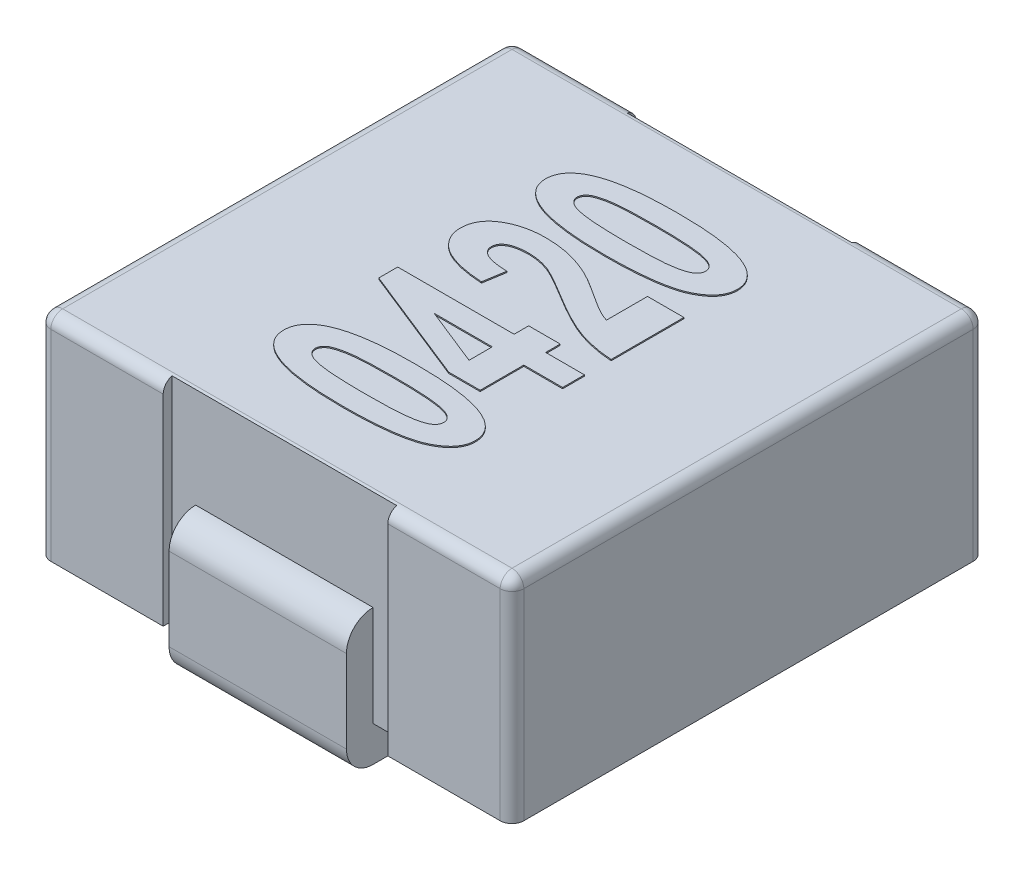
from build123d import *

# Parameters (mm, degrees)
EXTRUDE_1_DEPTH     = 1.8
CUT_EXTRUDE_1_DEPTH = 0.1
CUT_EXTRUDE_2_REACH = 5.3
EXTRUDE_START       = -0.75
EXTRUDE_1_2_DEPTH   = 1.5
EXTRUDE_2_DEPTH     = 1.5
FILLET_1_R          = 0.1
EXTRUDE_2_2_DEPTH   = 0.01


# Read off the part's stored shape, not the designer's step: Вытянуть-Тонкостенный1, Вытянуть-Тонкостенный2
with BuildPart() as part:
    # Эскиз1 → Extrude 1 (new body)
    with BuildSketch(Plane(origin=(0, 0, 0), x_dir=(1, 0, 0), z_dir=(0, 1, 0))):
        with BuildLine():
            Line((-1.900000000000001, -2.0000000000000013), (1.899999999999999, -2.000000000000001))
            ThreePointArc((1.899999999999999, -2.000000000000001), (1.970710678118654, -1.9707106781186554), (1.9999999999999996, -1.9000000000000004))
            Line((1.9999999999999996, -1.9000000000000004), (1.9999999999999991, 1.8999999999999992))
            ThreePointArc((1.9999999999999991, 1.8999999999999992), (1.9707106781186536, 1.970710678118654), (1.8999999999999988, 1.9999999999999991))
            Line((1.8999999999999988, 1.9999999999999991), (-1.9000000000000006, 1.9999999999999991))
            ThreePointArc((-1.9000000000000006, 1.9999999999999991), (-1.9707106781186554, 1.970710678118654), (-2.000000000000001, 1.8999999999999992))
            Line((-2.000000000000001, 1.8999999999999992), (-2.000000000000001, -1.9000000000000004))
            ThreePointArc((-2.000000000000001, -1.9000000000000004), (-1.9707106781186563, -1.9707106781186559), (-1.900000000000001, -2.0000000000000013))
        make_face()
    extrude(amount=EXTRUDE_1_DEPTH)

    # Эскиз2 → Вырез-Вытянуть1 (cut)
    with BuildSketch(Plane.XZ):
        Polygon((0.9499999999999995, 2.0000000000000013), (-0.9500000000000007, 2.000000000000001), (-0.9500000000000005, 1.000000000000001), (0.9499999999999994, 1.0000000000000013), align=None)
        Polygon((0.9499999999999995, -2), (-0.9500000000000003, -1.9999999999999996), (-0.9500000000000004, -1.0000000000000002), (0.9499999999999995, -1), align=None)
    extrude(amount=-CUT_EXTRUDE_1_DEPTH, mode=Mode.SUBTRACT)

    # Эскиз5 → Вырез-Вытянуть2 (cut, up to next)
    with BuildSketch(Plane.XZ.offset(-0.1), mode=Mode.PRIVATE) as cut_extrude_2_sk1:
        Polygon((-0.9500000000000007, 2.000000000000001), (0.9499999999999993, 2.000000000000001), (0.9499999999999995, 1.925000000000001), (-0.9500000000000006, 1.925000000000001), align=None)
    cut_extrude_2_tool1 = extrude(cut_extrude_2_sk1.sketch, amount=-CUT_EXTRUDE_2_REACH, mode=Mode.PRIVATE) & part.part
    # Эскиз5 → Вырез-Вытянуть2 (cut, up to next)
    with BuildSketch(Plane.XZ.offset(-0.1), mode=Mode.PRIVATE) as cut_extrude_2_sk2:
        Polygon((-0.9500000000000003, -1.9999999999999996), (0.9499999999999995, -1.9999999999999991), (0.9499999999999995, -1.9249999999999992), (-0.9500000000000003, -1.9249999999999992), align=None)
    cut_extrude_2_tool2 = extrude(cut_extrude_2_sk2.sketch, amount=-CUT_EXTRUDE_2_REACH, mode=Mode.PRIVATE) & part.part
    add(cut_extrude_2_tool1.solids().sort_by_distance((0, 0.1, 1.9625))[0], mode=Mode.SUBTRACT)
    add(cut_extrude_2_tool2.solids().sort_by_distance((0, 0.1, -1.9625))[0], mode=Mode.SUBTRACT)

    # Extrude 1 2 outline → Extrude 1 2 (add)
    with BuildSketch(Plane(origin=(0, 0, 0), x_dir=(0, 0, -1), z_dir=(1, 0, 0)).offset(EXTRUDE_START)):
        with BuildLine():
            Line((-1.925, -0.2), (-1.2, -0.2))
            Line((-1.2, -0.2), (-1.2, 0.1))
            Line((-1.2, 0.1), (-1.925, 0.1))
            Line((-1.925, 0.1), (-1.925, 0.95))
            ThreePointArc((-1.925, 0.95), (-2.084099026, 0.884099026), (-2.15, 0.725))
            Line((-2.15, 0.725), (-2.15, 0.025))
            ThreePointArc((-2.15, 0.025), (-2.084099026, -0.134099026), (-1.925, -0.2))
        make_face()
    extrude(amount=EXTRUDE_1_2_DEPTH)

    # Extrude 2 outline → Extrude 2 (add)
    with BuildSketch(Plane(origin=(0, 0, 0), x_dir=(0, 0, -1), z_dir=(1, 0, 0)).offset(EXTRUDE_START)):
        with BuildLine():
            Line((1.2, 0.1), (1.2, -0.2))
            Line((1.2, -0.2), (1.925, -0.2))
            ThreePointArc((1.925, -0.2), (2.084099026, -0.134099026), (2.15, 0.025))
            Line((2.15, 0.025), (2.15, 0.725))
            ThreePointArc((2.15, 0.725), (2.084099026, 0.884099026), (1.925, 0.95))
            Line((1.925, 0.95), (1.925, 0.1))
            Line((1.925, 0.1), (1.2, 0.1))
        make_face()
    extrude(amount=EXTRUDE_2_DEPTH)

    # Скругление1
    fillet_1_edges = [part.edges().sort_by_distance(p)[0] for p in [
        (1.4249999999999992, 1.8, -1.9999999999999991),
        (1.9707106781186536, 1.8, -1.970710678118654),
        (1.9999999999999993, 1.8, 4.4e-16),
        (1.970710678118654, 1.8, 1.9707106781186554),
        (1.4249999999999992, 1.8, 2.000000000000001),
    ]]
    fillet(fillet_1_edges, radius=FILLET_1_R)
    # the kernel refuses this fillet: 0.1 mm, written as the material it takes off along each edge
    with BuildSketch(Plane(origin=(-1.9000000000000008, 1.7, -1.899999999999999), x_dir=(0, 1, 0), z_dir=(-1, 0, 0))) as fillet_1_2_piece_1_section:
        Polygon((0, 0), (FILLET_1_R * 1.02, 0), (FILLET_1_R * 1.02, FILLET_1_R * 1.02), (0, FILLET_1_R * 1.02), align=None)
    fillet_1_2_piece_1 = extrude(amount=FILLET_1_R * 1.02, mode=Mode.PRIVATE)
    fillet_1_2_piece_1 = fillet_1_2_piece_1 - Plane(origin=(-1.9000000000000008, 1.7, -1.899999999999999), x_dir=(0, -0.7071067811865475, 0.7071067811865475), z_dir=(-1, 0, 0)) * Sphere(FILLET_1_R, mode=Mode.PRIVATE)
    add(fillet_1_2_piece_1, mode=Mode.SUBTRACT)
    with BuildSketch(Plane(origin=(-1.9000000000000008, 1.7, 1.9000000000000015), x_dir=(0, 1, 0), z_dir=(-1, 0, 0))) as fillet_1_2_piece_2_section:
        Polygon((0, 0), (FILLET_1_R * 1.02, 0), (FILLET_1_R * 1.02, -FILLET_1_R * 1.02), (0, -FILLET_1_R * 1.02), align=None)
    fillet_1_2_piece_2 = extrude(amount=FILLET_1_R * 1.02, mode=Mode.PRIVATE)
    fillet_1_2_piece_2 = fillet_1_2_piece_2 - Plane(origin=(-1.9000000000000008, 1.7, 1.9000000000000015), x_dir=(0, -0.7071067811865475, -0.7071067811865475), z_dir=(-1, 0, 0)) * Sphere(FILLET_1_R, mode=Mode.PRIVATE)
    add(fillet_1_2_piece_2, mode=Mode.SUBTRACT)
    with BuildSketch(Plane(origin=(-2.000000000000001, 1.8, -1.8999999999999992), x_dir=(0, -1, 0), z_dir=(0, 0, 1))) as fillet_1_2_piece_3:
        with BuildLine():
            CenterArc((FILLET_1_R, FILLET_1_R), FILLET_1_R, 180, 90)
            Line((0, FILLET_1_R), (-FILLET_1_R * 0.02, FILLET_1_R))
            Line((-FILLET_1_R * 0.02, FILLET_1_R), (-FILLET_1_R * 0.02, -FILLET_1_R * 0.02))
            Line((-FILLET_1_R * 0.02, -FILLET_1_R * 0.02), (FILLET_1_R, -FILLET_1_R * 0.02))
            Line((FILLET_1_R, -FILLET_1_R * 0.02), (FILLET_1_R, 0))
        make_face()
    extrude(amount=3.8, mode=Mode.SUBTRACT)

    # Эскиз4 → Extrude 2 2 (add)
    # profile 1 of 4: a face of its own
    with BuildSketch(Plane(origin=(0, 1.8, 0), x_dir=(1, 0, 0), z_dir=(0, 1, 0))):
        with BuildLine():
            add(Edge.make_bspline(
                [(-0.8000000000000009, -1.1307692307692314), (-0.7995398097090533, -1.1195023337721541), (-0.7986386939862038, -1.0974402037544084), (-0.7905291318273306, -1.0653858019362572), (-0.7776468300061087, -1.0352448636005964), (-0.7593364304188394, -1.0070730555165353), (-0.7359232969131421, -0.9807726208990243), (-0.7069450751003055, -0.9569828342028031), (-0.673590085410404, -0.9341762966133192), (-0.648573003572748, -0.9218091848470992), (-0.6355769230769241, -0.915384615384616)],
                knots=[0, 0, 0, 0, 0.9396298685640346, 1.8399241897919607, 2.7432644540746547, 3.666481804079429, 4.633505535992723, 5.6720286272651, 6.790646185339754, 8, 8, 8, 8], degree=3))
            add(Edge.make_bspline(
                [(-0.6355769230769241, -0.915384615384616), (-0.6180823381099843, -0.9077605548433487), (-0.5812074394794035, -0.8916906417734524), (-0.5198678052534151, -0.8737855551107404), (-0.4511173363630997, -0.8576671725223582), (-0.37406620503002863, -0.8452755577609069), (-0.28919793400555377, -0.8348905625659061), (-0.1962340513489554, -0.8283263787949772), (-0.09534956646967709, -0.8235316954926868), (-0.02543399017395746, -0.8232324336328406), (0.01089743589743496, -0.8230769230769237)],
                knots=[0, 0, 0, 0, 0.6959931905130678, 1.4670069850895826, 2.3278679470853567, 3.2729158257202946, 4.313905632018969, 5.448135814050374, 6.673931190613116, 8, 8, 8, 8], degree=3))
            add(Edge.make_bspline(
                [(0.01089743589743496, -0.8230769230769237), (0.04711830486126695, -0.8234279037358557), (0.11691397640757574, -0.824104224638438), (0.21774195527472628, -0.8280312730595805), (0.31051618696410394, -0.8354843097406582), (0.3954954163825903, -0.8450630340029712), (0.4725403429568272, -0.8581520822955994), (0.5417310474028674, -0.8739685780790399), (0.6032582314269574, -0.8924174492009397), (0.6404014525753764, -0.9084322582698952), (0.6580128205128197, -0.9160256410256417)],
                knots=[0, 0, 0, 0, 1.3207794150351386, 2.5450710839921746, 3.6783660632844826, 4.713891942915351, 5.662400210478151, 6.52611752934986, 7.301162212521988, 8, 8, 8, 8], degree=3))
            add(Edge.make_bspline(
                [(0.6580128205128197, -0.9160256410256417), (0.6708786680596294, -0.9224850306960514), (0.6955906439247617, -0.9348918527929162), (0.7288459770806922, -0.9571466101479028), (0.7570003759250178, -0.9812115230914181), (0.7802444307009208, -1.0071869712905073), (0.7985555540689112, -1.0351720529037798), (0.8109574406404649, -1.0654657770542466), (0.8191764375338697, -1.0974298964169515), (0.8200610554683201, -1.1194988493707225), (0.8205128205128197, -1.1307692307692314)],
                knots=[0, 0, 0, 0, 1.2090082135674984, 2.322193053020847, 3.35357277659622, 4.31399531255786, 5.243012363675325, 6.148517307358468, 7.054467325997787, 8, 8, 8, 8], degree=3))
            add(Edge.make_bspline(
                [(0.8205128205128197, -1.1307692307692314), (0.8199529691240295, -1.1420414941869446), (0.8188442114447237, -1.1643656481995903), (0.8100935064090723, -1.196885296938242), (0.7961728191017574, -1.2278336881440715), (0.7762632550031777, -1.2568356198887474), (0.7507958957431518, -1.2840407990219076), (0.7196940836645084, -1.3092961939440801), (0.6831873407703163, -1.3329442652295203), (0.6410343895580033, -1.3553901556266241), (0.5915494556738684, -1.375529544024376), (0.5335072189967572, -1.3919287909732188), (0.4671946263276258, -1.4067083166832601), (0.3920096105060163, -1.4182593878685674), (0.30828367480854757, -1.4275009896482744), (0.21577237565614577, -1.4335064721663917), (0.11467953447746193, -1.4379364737287457), (0.04434323361818046, -1.4382816655065502), (0.00769230769230675, -1.4384615384615391)],
                knots=[0, 0, 0, 0, 0.5709463050452833, 1.130730606131257, 1.6956820155888659, 2.2847203247224894, 2.905752519265767, 3.5793167801991084, 4.311109974114171, 5.10847224718865, 5.997836565709081, 7.014420582833356, 8.16324519443168, 9.44139050322947, 10.869501499122947, 12.433562193701734, 14.141596213321124, 15.999999999999998, 15.999999999999998, 15.999999999999998, 15.999999999999998], degree=3))
            add(Edge.make_bspline(
                [(0.00769230769230675, -1.4384615384615391), (-0.02831545648968043, -1.4381137515724938), (-0.09779178328008006, -1.4374427030887669), (-0.1981850317471278, -1.433462520700271), (-0.2907836309820539, -1.4261971520194556), (-0.37545674900364123, -1.415955693804704), (-0.4523901284533673, -1.4035176876137683), (-0.5213092744333714, -1.387493883777745), (-0.5827472821375719, -1.3691307642899329), (-0.6198892339263452, -1.35310933990469), (-0.6375000000000011, -1.3455128205128213)],
                knots=[0, 0, 0, 0, 1.3168390637451746, 2.5408170488100152, 3.673540426700608, 4.71256574662451, 5.659351526342241, 6.521795573419536, 7.2991129676330155, 8, 8, 8, 8], degree=3))
            add(Edge.make_bspline(
                [(-0.6375000000000011, -1.3455128205128213), (-0.6503680303058299, -1.3390552433203184), (-0.6750841986882452, -1.3266519025261916), (-0.7083106985460544, -1.30437320312567), (-0.7366241336012148, -1.2803374539441297), (-0.7595173954145332, -1.2540809860386117), (-0.7781480656084309, -1.2263322513063857), (-0.7904257844277703, -1.1960596828955514), (-0.7986685677202402, -1.1641119824065012), (-0.7995499085422462, -1.1420407673829218), (-0.8000000000000009, -1.1307692307692314)],
                knots=[0, 0, 0, 0, 1.2091296293630474, 2.3224262614587983, 3.3539095623202826, 4.321163245365618, 5.242735490579329, 6.148331370454524, 7.0543723699829775, 8, 8, 8, 8], degree=3))
        make_face()
        with BuildLine():
            add(Edge.make_bspline(
                [(-0.5333333333333343, -1.1307692307692314), (-0.5328680955384337, -1.13638229184593), (-0.5319253604856875, -1.1477563235523176), (-0.5251454027992006, -1.164101144608742), (-0.5140014999332745, -1.1792258676696865), (-0.4985566467805247, -1.1936345093874472), (-0.4772858177960856, -1.2066173439950971), (-0.44951491416779454, -1.2175726394123123), (-0.4151646226257487, -1.2268915004593446), (-0.3898905430045098, -1.231703769559188), (-0.3762820512820522, -1.2342948717948723)],
                knots=[0, 0, 0, 0, 0.6605373500450775, 1.338480493977583, 2.0511830084587044, 2.861689582077338, 3.8118113417669455, 4.969049188616237, 6.368024883753588, 8, 8, 8, 8], degree=3))
            add(Edge.make_bspline(
                [(-0.3762820512820522, -1.2342948717948723), (-0.3659262582606298, -1.2358426048044227), (-0.3435514675820032, -1.2391866463513572), (-0.3074425297747664, -1.243388329278277), (-0.26625584920579753, -1.2462907199165012), (-0.22033376163735055, -1.2494015472556854), (-0.1694485738051372, -1.2510206063112788), (-0.11379200303434421, -1.2527581710071385), (-0.05310119253806876, -1.253670252958267), (-0.01100447836514975, -1.2537859562097458), (0.01089743589743496, -1.2538461538461545)],
                knots=[0, 0, 0, 0, 0.647628605133843, 1.3992703839662433, 2.247685975798197, 3.2011106989542455, 4.245944809745224, 5.3962307697779845, 6.645321100225803, 8, 8, 8, 8], degree=3))
            add(Edge.make_bspline(
                [(0.01089743589743496, -1.2538461538461545), (0.03269210102154648, -1.2537467389519443), (0.07446611173818736, -1.2535561896210652), (0.13441324754046996, -1.253165368815459), (0.18900504271054971, -1.2514054779232604), (0.23836141458052082, -1.2494587575242926), (0.2824231005897453, -1.2475551706857002), (0.3210757641168179, -1.2441198184946975), (0.3544664554785493, -1.2408589152572649), (0.39064804685851884, -1.2354122929177396), (0.4285720973948143, -1.228066806289273), (0.4668698659157808, -1.2176559769613633), (0.49695184535206216, -1.2065626018853837), (0.5192072835782681, -1.1936011467571173), (0.5345297467819871, -1.1789800617965225), (0.5461072076566047, -1.1642840503518543), (0.5523376146690662, -1.1476710219308732), (0.5533465426486964, -1.1363669137791863), (0.553846153846153, -1.1307692307692314)],
                knots=[0, 0, 0, 0, 1.772229522250977, 3.3968466426656168, 4.874325467949006, 6.2131839487891, 7.41357201145584, 8.459660884726505, 9.368179201659817, 10.14095793959944, 11.43408160705417, 12.506883431617585, 13.365124891268312, 14.035567992288453, 14.582591736055134, 15.079517173986284, 15.544185971419282, 16, 16, 16, 16], degree=3))
            add(Edge.make_bspline(
                [(0.553846153846153, -1.1307692307692314), (0.5534134307771246, -1.1250371402162993), (0.5525523214896046, -1.113630407445806), (0.5454614897796114, -1.0973411137719793), (0.534744598235889, -1.082008030929305), (0.5189168337016925, -1.0679530611320889), (0.49783065189643255, -1.0548902177805892), (0.47001639175513255, -1.0439767704057281), (0.43568109479905637, -1.0346434364681154), (0.41040464156015904, -1.0298334584024305), (0.3967948717948709, -1.0272435897435905)],
                knots=[0, 0, 0, 0, 0.6728039188749158, 1.3388648414880218, 2.061605897356789, 2.863308736394572, 3.8131310992739493, 4.9700042841033545, 6.368539142204354, 8, 8, 8, 8], degree=3))
            add(Edge.make_bspline(
                [(0.3967948717948709, -1.0272435897435905), (0.3864387661752054, -1.025698493532458), (0.36416827061119755, -1.0223758103173846), (0.32827728568319153, -1.0181436610266799), (0.2874096628645271, -1.0152485419154011), (0.24170202333930113, -1.0121260188469035), (0.19092278105247718, -1.010520179935171), (0.13526640811934967, -1.0087795742737464), (0.0746823683961193, -1.0078700636258493), (0.03269250596262267, -1.0077530462221502), (0.01089743589743496, -1.0076923076923083)],
                knots=[0, 0, 0, 0, 0.6497692285958724, 1.3973093027937435, 2.2419195300984103, 3.1918786807218176, 4.24016630853437, 5.394254338294392, 6.647473319092668, 8, 8, 8, 8], degree=3))
            add(Edge.make_bspline(
                [(0.01089743589743496, -1.0076923076923083), (-0.01089723859933591, -1.0077913102084517), (-0.05267126728062863, -1.0079810691309585), (-0.11272507563755345, -1.008377983374653), (-0.1674239510375948, -1.0101273714451857), (-0.21688738115800948, -1.0120761796184563), (-0.2610540621072981, -1.0140007841055023), (-0.29981669927564814, -1.0173996705021162), (-0.33331207984639166, -1.0206840652974234), (-0.3693922122945961, -1.0260980917295484), (-0.4072029563326054, -1.0335020431554176), (-0.445471395481054, -1.0439473707084854), (-0.4758061576745857, -1.0549665176149143), (-0.49827997127533624, -1.0679883916788366), (-0.514085291822131, -1.082333077830839), (-0.5251356960000242, -1.0974464898318035), (-0.5319276652667223, -1.1137799599735614), (-0.5328688571094031, -1.1251554500097822), (-0.5333333333333343, -1.1307692307692314)],
                knots=[0, 0, 0, 0, 1.7690472389928014, 3.3907471346358555, 4.874240911918719, 6.210695287153331, 7.408927887004913, 8.461780351156994, 9.368667297777701, 10.140058404595537, 11.42235567177241, 12.493231132260076, 13.358012728297753, 14.034682898559664, 14.587091034330724, 15.078019327131901, 15.545004448559958, 16, 16, 16, 16], degree=3))
        make_face(mode=Mode.SUBTRACT)
    # profile 2 of 4: a face of its own
    with BuildSketch(Plane(origin=(0, 1.8, 0), x_dir=(1, 0, 0), z_dir=(0, 1, 0))):
        Polygon((0.7999999999999992, -0.37179487179487236), (0.47179487179487095, -0.37179487179487236), (0.47179487179487095, -0.7410256410256416), (0.20608974358974275, -0.7410256410256416), (-0.7794871794871806, -0.347435897435898), (-0.7794871794871806, -0.1871794871794877), (0.2051282051282042, -0.1871794871794877), (0.2051282051282042, -0.0641025641025646), (0.47179487179487095, -0.0641025641025646), (0.47179487179487095, -0.1871794871794877), (0.7999999999999992, -0.1871794871794877), align=None)
        Polygon((0.2051282051282042, -0.37179487179487236), (-0.2871794871794881, -0.37179487179487236), (0.2051282051282042, -0.5685897435897442), align=None, mode=Mode.SUBTRACT)
    # profile 3 of 4: a face of its own
    with BuildSketch(Plane(origin=(0, 1.8, 0), x_dir=(1, 0, 0), z_dir=(0, 1, 0))):
        with BuildLine():
            Line((0.4923076923076914, 0.6538461538461533), (0.799999999999999, 0.6538461538461533))
            Line((0.799999999999999, 0.6538461538461533), (0.799999999999999, 0.03846153846153787))
            add(Edge.make_bspline(
                [(0.799999999999999, 0.03846153846153787), (0.773788401266987, 0.04057816940803173), (0.7217992805218669, 0.04477637887136888), (0.6450764490261943, 0.05700568391438592), (0.5705731000130544, 0.07460413385941563), (0.5092134501877835, 0.09260664620049515), (0.45964350972366136, 0.11111936803497845), (0.4195082403155858, 0.12780499158292835), (0.3766992098057276, 0.14771702617547772), (0.3310103066241404, 0.17078828118886974), (0.2820599230327283, 0.1961273018186772), (0.23052993783418105, 0.2252246701452584), (0.1759992972595677, 0.25689520704747726), (0.13895620768894945, 0.2794206476808836), (0.11987179487179384, 0.2910256410256405)],
                knots=[0, 0, 0, 0, 1.2891047351005824, 2.55686127385444, 3.804708595292519, 5.041066992829318, 5.689154205248216, 6.39838269187273, 7.1718554675095945, 8.003542894842647, 8.908005235861982, 9.874257051222207, 10.904827959873758, 12, 12, 12, 12], degree=3))
            add(Edge.make_bspline(
                [(0.11987179487179384, 0.2910256410256405), (0.10458712817967562, 0.3002019502224941), (0.07541588572201202, 0.31771521013452986), (0.03375257170440584, 0.34297639512309225), (-0.00429707810703568, 0.36488921875457697), (-0.03836137203187764, 0.38434630000830344), (-0.06872021221447076, 0.40068856603252856), (-0.09540832221769124, 0.41409401066575574), (-0.11802046261247556, 0.42523264848321046), (-0.13213012562762017, 0.4310454668590115), (-0.13846153846153944, 0.4336538461538456)],
                knots=[0, 0, 0, 0, 1.4487007477585656, 2.7648886045553036, 3.9591202969100547, 5.01657916950254, 5.952674831107404, 6.760260168098444, 7.44369297310663, 8, 8, 8, 8], degree=3))
            add(Edge.make_bspline(
                [(-0.13846153846153944, 0.4336538461538456), (-0.1539634631007872, 0.4392116653043082), (-0.18435894584982826, 0.4501091893241627), (-0.23104984523816655, 0.4607415854920688), (-0.27723225681612435, 0.46793766250640473), (-0.30809284904072093, 0.4688020811032262), (-0.32339743589743686, 0.46923076923076873)],
                knots=[0, 0, 0, 0, 1.0429282322537783, 2.044927183538152, 3.0304274942949236, 4, 4, 4, 4], degree=3))
            add(Edge.make_bspline(
                [(-0.32339743589743686, 0.46923076923076873), (-0.33933591722435136, 0.4688948726419824), (-0.3692874961151957, 0.46826365609306236), (-0.4113870388121255, 0.46279467776232636), (-0.44786913832330194, 0.4542814297780782), (-0.4784090592529668, 0.4415740381697115), (-0.5026339983186996, 0.42557546148622744), (-0.5207584831612457, 0.40660237860079984), (-0.5312438608696922, 0.3837299377831422), (-0.5326305612254031, 0.3675133494876026), (-0.5333333333333344, 0.35929487179487124)],
                knots=[0, 0, 0, 0, 1.4580312336109473, 2.739930902015702, 3.8782039390313683, 4.877043567908527, 5.750258798504215, 6.518463335709854, 7.249165372855807, 8, 8, 8, 8], degree=3))
            add(Edge.make_bspline(
                [(-0.5333333333333344, 0.35929487179487124), (-0.5326665907861076, 0.3511658753179255), (-0.5313350230416265, 0.33493125890005726), (-0.5199346499375683, 0.3121103179289438), (-0.5009711155126979, 0.29305067526543643), (-0.4806081321754736, 0.27964887087470947), (-0.4606473483517202, 0.2706642978031629), (-0.44276342248981615, 0.26427804527883364), (-0.42245082531046596, 0.25899730635166796), (-0.4000240425304302, 0.2540973388206316), (-0.3751648341033339, 0.2504152282046901), (-0.34803051186542816, 0.24713847760303534), (-0.31839870471223236, 0.24500721708224812), (-0.29786548125027873, 0.24407492914317738), (-0.2871794871794882, 0.243589743589743)],
                knots=[0, 0, 0, 0, 0.9779852991887782, 1.9531582083560441, 3.002652505801253, 4.194234772603545, 4.875468122110543, 5.642662910505996, 6.484547082118991, 7.408173722055797, 8.413602140428479, 9.517816346870632, 10.70821063000159, 12, 12, 12, 12], degree=3))
            Line((-0.2871794871794882, 0.243589743589743), (-0.31730769230769335, 0.05897435897435838))
            add(Edge.make_bspline(
                [(-0.31730769230769335, 0.05897435897435838), (-0.3380505790175432, 0.06050976093725387), (-0.37811705290713254, 0.06347550738888749), (-0.43585680249396835, 0.07058865728557667), (-0.48909137834483973, 0.0793055514277526), (-0.5378052857363448, 0.0905413856177031), (-0.5819654122832557, 0.10383975831493321), (-0.6216351786298643, 0.11923353466612467), (-0.656924920247761, 0.1363845311218027), (-0.6875099673208708, 0.15608725151513753), (-0.714129193253916, 0.17740088739706245), (-0.7368615503178382, 0.20021406016938098), (-0.7564172018136949, 0.22402880081684554), (-0.7722597555574268, 0.24936878524480346), (-0.7849145616152589, 0.27586722920554685), (-0.7934840568819577, 0.30397208953885485), (-0.7992700011080817, 0.3330943590924594), (-0.7997553166005036, 0.35306988636115827), (-0.800000000000001, 0.3631410256410251)],
                knots=[0, 0, 0, 0, 1.5795600954277451, 3.0510412656518278, 4.41707779247932, 5.674853277156021, 6.8453698278796855, 7.916761963903773, 8.903834858479486, 9.819948492033987, 10.674094802882092, 11.488866127405426, 12.261919773537588, 13.009380386341835, 13.753530216831972, 14.48496241451865, 15.236157607637976, 16, 16, 16, 16], degree=3))
            add(Edge.make_bspline(
                [(-0.800000000000001, 0.3631410256410251), (-0.7996308030868308, 0.37416685959521145), (-0.7989050597270065, 0.3958407292656275), (-0.7931905163539364, 0.42741976621234534), (-0.7829293387537353, 0.45691216226282266), (-0.7694662113454322, 0.48487826872800327), (-0.7517492486865455, 0.5108991315498193), (-0.7298391009310012, 0.5347831760624705), (-0.7044244868207616, 0.5570250025365696), (-0.6751623031603196, 0.5769298721571852), (-0.6432906677528594, 0.5951899402587781), (-0.609007526692464, 0.610805024291586), (-0.5727940159771089, 0.6238269757373086), (-0.5350418000449393, 0.6353411544350501), (-0.49507505881733166, 0.6433809495877626), (-0.4533681130893045, 0.6495877471539075), (-0.4096736457952127, 0.6530494228507187), (-0.3799201342896268, 0.6535770328054511), (-0.36474358974359083, 0.6538461538461533)],
                knots=[0, 0, 0, 0, 0.9071897646530167, 1.7832948334905274, 2.62858981553185, 3.4701264864607646, 4.331009266991206, 5.208745366325493, 6.131021837252149, 7.104202236203184, 8.1162869345169, 9.151072103241415, 10.19977253378947, 11.281996859502973, 12.396008898681055, 13.551211837457991, 14.7509325537711, 16, 16, 16, 16], degree=3))
            add(Edge.make_bspline(
                [(-0.36474358974359083, 0.6538461538461533), (-0.34731987184190044, 0.6536348814121103), (-0.3128484304724135, 0.6532168956891898), (-0.26182228541843594, 0.6488286414508069), (-0.21206533166481037, 0.6421774557804062), (-0.16315662247856166, 0.6327856619261165), (-0.11435290296786431, 0.6205028313553527), (-0.06487063969274322, 0.6049428220526616), (-0.01421517167791525, 0.5864738150422095), (0.01940947320469318, 0.5718650433805973), (0.03653846153846046, 0.5644230769230763)],
                knots=[0, 0, 0, 0, 1.0089272018039115, 1.9960822988123512, 2.9639655722642155, 3.9154103909977893, 4.878912330371526, 5.877060799549712, 6.9185372537088545, 8, 8, 8, 8], degree=3))
            add(Edge.make_bspline(
                [(0.03653846153846046, 0.5644230769230763), (0.04264205671249839, 0.5615677570142085), (0.05558373089794029, 0.5555135186674464), (0.07585150900686038, 0.545265323423857), (0.09775309897917715, 0.5329013634260423), (0.12210202385260199, 0.519651418173429), (0.1477164978755489, 0.5036714892637497), (0.1757963570791604, 0.4869594497348761), (0.20523776441276925, 0.4677369651734014), (0.2360317873199748, 0.44790653607591163), (0.26647401311541075, 0.42812995652253116), (0.29479456138460414, 0.4096042457978036), (0.32043717156619256, 0.3930827293788054), (0.3436707800369689, 0.37919170822284365), (0.36365124223690715, 0.3665581106323443), (0.38111233997751687, 0.35626575756013784), (0.39582203320457926, 0.3478600472682808), (0.41865072102709405, 0.33590511743058926), (0.4501608350780653, 0.3211704752309656), (0.47855087964457216, 0.31101212247272275), (0.4923076923076914, 0.306089743589743)],
                knots=[0, 0, 0, 0, 0.6930528308506445, 1.4695050497973114, 2.3350803306034784, 3.279634317899734, 4.319881198590907, 5.439295331191883, 6.640251146459127, 7.935623074234618, 9.206576242840859, 10.373882286596757, 11.41639013511519, 12.343591258648981, 13.157770686317058, 13.847505366877245, 14.428124922930223, 14.899986278213477, 16.497842864465653, 18, 18, 18, 18], degree=3))
            Line((0.4923076923076914, 0.306089743589743), (0.4923076923076914, 0.6538461538461533))
        make_face()
    # profile 4 of 4: a face of its own
    with BuildSketch(Plane(origin=(0, 1.8, 0), x_dir=(1, 0, 0), z_dir=(0, 1, 0))):
        with BuildLine():
            add(Edge.make_bspline(
                [(-0.8000000000000009, 1.0846153846153839), (-0.7995398097090533, 1.0958822816124614), (-0.7986386939862038, 1.1179444116302073), (-0.7905291318273309, 1.1499988134483583), (-0.7776468300061086, 1.1801397517840186), (-0.7593364304188395, 1.208311559868081), (-0.7359232969131421, 1.2346119944855913), (-0.7069450751003058, 1.2584017811818125), (-0.6735900854104039, 1.281208318771296), (-0.648573003572748, 1.2935754305375162), (-0.6355769230769241, 1.2999999999999996)],
                knots=[0, 0, 0, 0, 0.939629868564034, 1.8399241897919654, 2.743264454074653, 3.6664818040794316, 4.633505535992725, 5.672028627265102, 6.790646185339752, 7.999999999999999, 7.999999999999999, 7.999999999999999, 7.999999999999999], degree=3))
            add(Edge.make_bspline(
                [(-0.6355769230769241, 1.2999999999999996), (-0.6180823381099843, 1.3076240605412668), (-0.5812074394794035, 1.3236939736111633), (-0.5198678052534149, 1.3415990602738743), (-0.4511173363630997, 1.3577174428622576), (-0.37406620503002863, 1.3701090576237085), (-0.28919793400555377, 1.380494052818709), (-0.1962340513489554, 1.3870582365896384), (-0.09534956646967709, 1.3918529198919283), (-0.02543399017395746, 1.3921521817517748), (0.01089743589743496, 1.3923076923076918)],
                knots=[0, 0, 0, 0, 0.6959931905130683, 1.4670069850895822, 2.3278679470853567, 3.2729158257202946, 4.313905632018969, 5.448135814050374, 6.673931190613116, 8, 8, 8, 8], degree=3))
            add(Edge.make_bspline(
                [(0.01089743589743496, 1.3923076923076918), (0.04711830486126694, 1.39195671164876), (0.11691397640757578, 1.3912803907461777), (0.21774195527472648, 1.3873533423250353), (0.3105161869641038, 1.3799003056439574), (0.3954954163825902, 1.3703215813816445), (0.47254034295682723, 1.3572325330890165), (0.5417310474028674, 1.341416037305575), (0.6032582314269574, 1.3229671661836757), (0.6404014525753764, 1.3069523571147204), (0.6580128205128197, 1.2993589743589737)],
                knots=[0, 0, 0, 0, 1.3207794150351384, 2.545071083992174, 3.6783660632844826, 4.713891942915351, 5.662400210478151, 6.52611752934986, 7.301162212521988, 8, 8, 8, 8], degree=3))
            add(Edge.make_bspline(
                [(0.6580128205128197, 1.2993589743589737), (0.6708786680596294, 1.292899584688564), (0.6955906439247618, 1.2804927625916998), (0.7288459770806922, 1.2582380052367126), (0.7570003759250177, 1.2341730922931975), (0.7802444307009209, 1.2081976440941085), (0.7985555540689112, 1.1802125624808355), (0.8109574406404649, 1.1499188383303693), (0.8191764375338695, 1.1179547189676637), (0.8200610554683201, 1.095885766013893), (0.8205128205128197, 1.0846153846153839)],
                knots=[0, 0, 0, 0, 1.2090082135674955, 2.3221930530208463, 3.3535727765962204, 4.313995312557855, 5.243012363675326, 6.148517307358463, 7.054467325997788, 8, 8, 8, 8], degree=3))
            add(Edge.make_bspline(
                [(0.8205128205128197, 1.0846153846153839), (0.8199529691240295, 1.073343121197671), (0.8188442114447237, 1.0510189671850252), (0.8100935064090724, 1.0184993184463735), (0.7961728191017574, 0.9875509272405442), (0.7762632550031778, 0.9585489954958679), (0.7507958957431515, 0.9313438163627079), (0.7196940836645084, 0.9060884214405355), (0.6831873407703163, 0.8824403501550958), (0.6410343895580032, 0.8599944597579912), (0.5915494556738682, 0.8398550713602398), (0.5335072189967572, 0.8234558244113964), (0.4671946263276258, 0.8086762987013554), (0.3920096105060163, 0.7971252275160484), (0.30828367480854757, 0.7878836257363406), (0.21577237565614585, 0.7818781432182235), (0.11467953447746182, 0.7774481416558701), (0.04434323361818045, 0.7771029498780652), (0.00769230769230675, 0.7769230769230763)],
                knots=[0, 0, 0, 0, 0.5709463050452798, 1.1307306061312536, 1.6956820155888626, 2.2847203247224894, 2.9057525192657643, 3.5793167801991075, 4.311109974114168, 5.108472247188649, 5.997836565709081, 7.014420582833356, 8.16324519443168, 9.441390503229472, 10.869501499122947, 12.433562193701734, 14.141596213321124, 15.999999999999998, 15.999999999999998, 15.999999999999998, 15.999999999999998], degree=3))
            add(Edge.make_bspline(
                [(0.00769230769230675, 0.7769230769230763), (-0.02831545648968043, 0.7772708638121217), (-0.09779178328008008, 0.7779419122958489), (-0.1981850317471278, 0.7819220946843447), (-0.2907836309820539, 0.7891874633651601), (-0.37545674900364123, 0.7994289215799117), (-0.45239012845336746, 0.811866927770847), (-0.5213092744333714, 0.8278907316068707), (-0.5827472821375719, 0.8462538510946831), (-0.6198892339263452, 0.8622752754799256), (-0.6375000000000011, 0.8698717948717943)],
                knots=[0, 0, 0, 0, 1.3168390637451743, 2.5408170488100152, 3.673540426700608, 4.71256574662451, 5.659351526342241, 6.521795573419537, 7.2991129676330155, 8, 8, 8, 8], degree=3))
            add(Edge.make_bspline(
                [(-0.6375000000000011, 0.8698717948717943), (-0.6503680303058298, 0.8763293720642973), (-0.6750841986882452, 0.888732712858424), (-0.7083106985460546, 0.9110114122589451), (-0.7366241336012148, 0.9350471614404857), (-0.7595173954145332, 0.9613036293460038), (-0.7781480656084309, 0.9890523640782296), (-0.7904257844277703, 1.0193249324890636), (-0.7986685677202402, 1.051272632978114), (-0.7995499085422462, 1.0733438480016937), (-0.8000000000000009, 1.0846153846153839)],
                knots=[0, 0, 0, 0, 1.2091296293630491, 2.322426261458797, 3.3539095623202857, 4.32116324536562, 5.242735490579328, 6.148331370454524, 7.054372369982984, 8, 8, 8, 8], degree=3))
        make_face()
        with BuildLine():
            add(Edge.make_bspline(
                [(-0.5333333333333343, 1.0846153846153839), (-0.5328680955384337, 1.0790023235386856), (-0.5319253604856875, 1.0676282918322981), (-0.5251454027992006, 1.0512834707758734), (-0.5140014999332744, 1.0361587477149292), (-0.4985566467805247, 1.0217501059971683), (-0.4772858177960856, 1.0087672713895186), (-0.44951491416779454, 0.9978119759723031), (-0.4151646226257487, 0.9884931149252707), (-0.3898905430045098, 0.9836808458254275), (-0.3762820512820522, 0.981089743589743)],
                knots=[0, 0, 0, 0, 0.6605373500450693, 1.3384804939775832, 2.051183008458698, 2.8616895820773323, 3.81181134176694, 4.969049188616236, 6.368024883753588, 8, 8, 8, 8], degree=3))
            add(Edge.make_bspline(
                [(-0.3762820512820522, 0.981089743589743), (-0.3659262582606298, 0.9795420105801926), (-0.3435514675820032, 0.9761979690332582), (-0.3074425297747664, 0.9719962861063381), (-0.26625584920579753, 0.9690938954681146), (-0.22033376163735055, 0.96598306812893), (-0.16944857380513728, 0.9643640090733365), (-0.1137920030343442, 0.9626264443774771), (-0.0531011925380688, 0.961714362426348), (-0.01100447836514976, 0.9615986591748696), (0.01089743589743496, 0.9615384615384609)],
                knots=[0, 0, 0, 0, 0.6476286051338432, 1.3992703839662437, 2.247685975798198, 3.201110698954247, 4.245944809745225, 5.396230769777985, 6.645321100225805, 8, 8, 8, 8], degree=3))
            add(Edge.make_bspline(
                [(0.01089743589743496, 0.9615384615384609), (0.03269210102154648, 0.961637876432671), (0.07446611173818736, 0.9618284257635498), (0.13441324754047002, 0.9622192465691564), (0.18900504271054971, 0.963979137461355), (0.23836141458052085, 0.9659258578603227), (0.2824231005897453, 0.9678294446989153), (0.3210757641168179, 0.9712647968899183), (0.3544664554785493, 0.9745257001273505), (0.39064804685851884, 0.979972322466876), (0.4285720973948143, 0.9873178090953423), (0.4668698659157808, 0.997728638423252), (0.49695184535206216, 1.0088220134992318), (0.5192072835782681, 1.0217834686274985), (0.5345297467819871, 1.0364045535880932), (0.5461072076566048, 1.051100565032761), (0.5523376146690663, 1.0677135934537425), (0.5533465426486963, 1.079017701605429), (0.553846153846153, 1.0846153846153839)],
                knots=[0, 0, 0, 0, 1.7722295222509779, 3.3968466426656185, 4.874325467949009, 6.213183948789103, 7.4135720114558445, 8.459660884726508, 9.368179201659823, 10.140957939599446, 11.434081607054177, 12.50688343161759, 13.36512489126832, 14.035567992288462, 14.582591736055141, 15.079517173986288, 15.544185971419287, 16, 16, 16, 16], degree=3))
            add(Edge.make_bspline(
                [(0.553846153846153, 1.0846153846153839), (0.5534134307771246, 1.0903474751683164), (0.5525523214896046, 1.1017542079388094), (0.5454614897796114, 1.1180435016126364), (0.534744598235889, 1.133376584455311), (0.5189168337016924, 1.1474315542525262), (0.49783065189643244, 1.160494397604026), (0.4700163917551327, 1.1714078449788874), (0.43568109479905637, 1.1807411789165003), (0.41040464156015904, 1.185551156982185), (0.3967948717948709, 1.1881410256410252)],
                knots=[0, 0, 0, 0, 0.6728039188749237, 1.3388648414880295, 2.0616058973567966, 2.863308736394573, 3.8131310992739493, 4.970004284103357, 6.368539142204356, 8, 8, 8, 8], degree=3))
            add(Edge.make_bspline(
                [(0.3967948717948709, 1.1881410256410252), (0.3864387661752054, 1.1896861218521577), (0.36416827061119755, 1.193008805067231), (0.32827728568319153, 1.197240954357936), (0.28740966286452707, 1.2001360734692144), (0.24170202333930113, 1.2032585965377118), (0.19092278105247712, 1.2048644354494442), (0.1352664081193497, 1.2066050411108689), (0.07468236839611928, 1.2075145517587667), (0.03269250596262267, 1.2076315691624655), (0.01089743589743496, 1.2076923076923072)],
                knots=[0, 0, 0, 0, 0.6497692285958725, 1.3973093027937438, 2.2419195300984103, 3.1918786807218176, 4.240166308534369, 5.394254338294392, 6.647473319092668, 8, 8, 8, 8], degree=3))
            add(Edge.make_bspline(
                [(0.01089743589743496, 1.2076923076923072), (-0.01089723859933591, 1.207593305176164), (-0.05267126728062863, 1.2074035462536574), (-0.11272507563755345, 1.207006632009962), (-0.1674239510375948, 1.2052572439394298), (-0.21688738115800948, 1.2033084357661594), (-0.2610540621072981, 1.2013838312791132), (-0.29981669927564814, 1.197984944882499), (-0.33331207984639166, 1.1947005500871921), (-0.3693922122945961, 1.1892865236550672), (-0.4072029563326054, 1.1818825722291975), (-0.44547139548105413, 1.1714372446761303), (-0.4758061576745857, 1.1604180977697014), (-0.49827997127533624, 1.147396223705779), (-0.514085291822131, 1.1330515375537762), (-0.5251356960000243, 1.1179381255528118), (-0.5319276652667224, 1.101604655411054), (-0.532868857109403, 1.090229165374833), (-0.5333333333333343, 1.0846153846153839)],
                knots=[0, 0, 0, 0, 1.7690472389928011, 3.390747134635855, 4.874240911918718, 6.21069528715333, 7.408927887004912, 8.461780351156992, 9.3686672977777, 10.140058404595536, 11.422355671772408, 12.493231132260075, 13.358012728297751, 14.034682898559662, 14.587091034330726, 15.078019327131898, 15.54500444855996, 16, 16, 16, 16], degree=3))
        make_face(mode=Mode.SUBTRACT)
    extrude(amount=EXTRUDE_2_2_DEPTH)


solid = part.part
